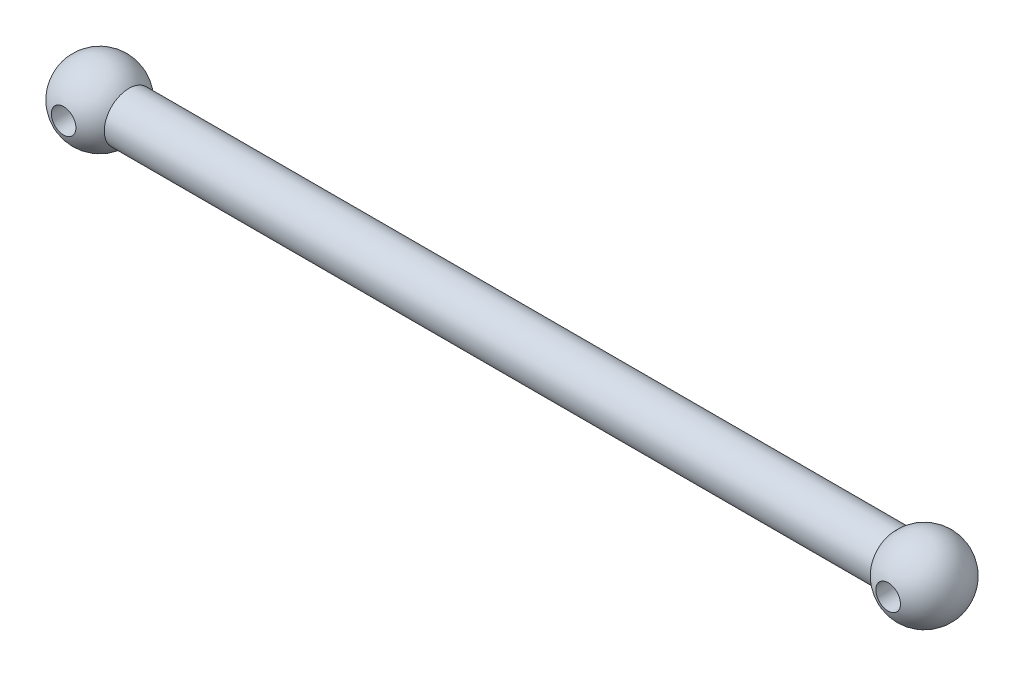
from build123d import *

# Parameters (mm, degrees)
CUT_EXTRUDE1_DEPTH      = 37.861633171
CUT_EXTRUDE1_DEPTH_BACK = 37.861633171
SKETCH2_R               = 1


with BuildPart() as part:
    # Sketch1 → Revolve2 (revolve)
    with BuildSketch(Plane(origin=(0, 0, 0), x_dir=(1, 0, 0), z_dir=(0, 1, 0))):
        with BuildLine():
            ThreePointArc((-36.6, 0), (-34.56478027, -2.911398801), (-31.131456144, -2))
            Line((-31.131456144, -2), (31.131456144, -2))
            ThreePointArc((31.131456144, -2), (34.56478027, -2.911398801), (36.6, 0))
            Line((36.6, 0), (-36.6, 0))
        make_face()
    revolve(axis=Axis((-33.5, 0, 0), (1, 0, 0)))

    # Sketch2 → Cut-Extrude1 (cut, two sides: drawn at the far end of the back side and taken through both)
    with BuildSketch(Plane.XY.offset(-CUT_EXTRUDE1_DEPTH_BACK)):
        with Locations((33.5, 0)):
            Circle(SKETCH2_R)
        with Locations((-33.5, 0)):
            Circle(SKETCH2_R)
    extrude(amount=CUT_EXTRUDE1_DEPTH + CUT_EXTRUDE1_DEPTH_BACK, mode=Mode.SUBTRACT)


solid = part.part
